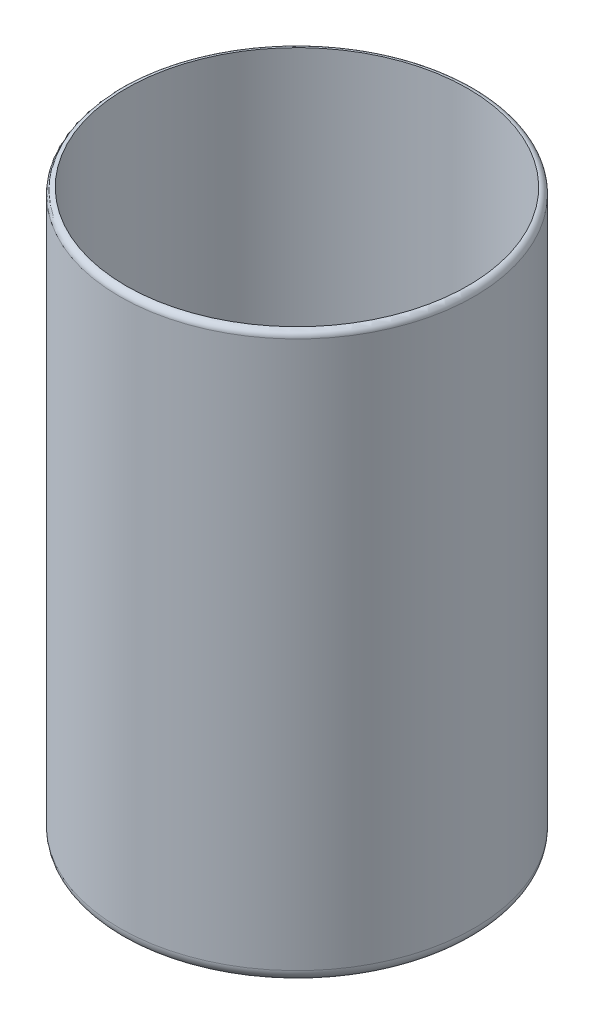
from build123d import *

# Parameters (mm, degrees)
SKETCH1_R           = 14.25
BOSS_EXTRUDE1_DEPTH = 0.5
SKETCH2_R           = 14.25
SKETCH2_R_2         = 13.75
BOSS_EXTRUDE2_DEPTH = 45
FILLET1_R           = 1
FILLET2_R           = 0.5


with BuildPart() as part:
    # Sketch1 → Boss-Extrude1 (new body)
    with BuildSketch(Plane(origin=(0, 0, 0), x_dir=(1, 0, 0), z_dir=(0, 1, 0))):
        with Locations(Location((0, 0, 0), (0, 0, 270))):
            Circle(SKETCH1_R)
    extrude(amount=BOSS_EXTRUDE1_DEPTH)

    # Sketch2 → Boss-Extrude2 (add)
    with BuildSketch(Plane(origin=(0, 0.5, 0), x_dir=(1, 0, 0), z_dir=(0, 1, 0))):
        with Locations(Location((0, 0, 0), (0, 0, 270))):
            Circle(SKETCH2_R)
        with Locations(Location((0, 0, 0), (0, 0, 90))):
            Circle(SKETCH2_R_2, mode=Mode.SUBTRACT)
    extrude(amount=BOSS_EXTRUDE2_DEPTH)

    # Fillet1
    fillet1_edges = [part.edges().sort_by_distance(p)[0] for p in [
        (0, 0, -14.25),
        (0, 0.5, 13.75),
    ]]
    fillet(fillet1_edges, radius=FILLET1_R)

    # Fillet2
    fillet2_edges = [part.edges().sort_by_distance(p)[0] for p in [
        (0, 45.5, -14.25),
    ]]
    fillet(fillet2_edges, radius=FILLET2_R - 0.0001)  # a hair under: the kernel refuses the full size


solid = part.part
